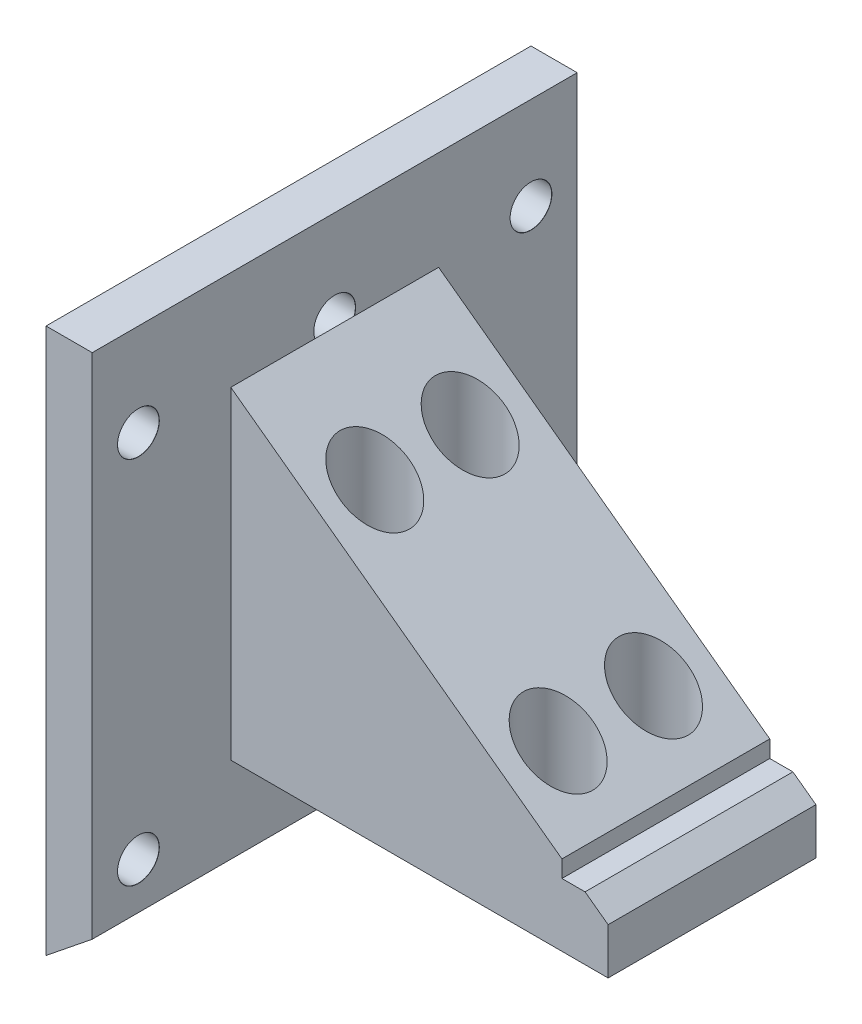
from build123d import *

# Parameters (mm, degrees)
BOSS_EXTRUDE1_DEPTH           = 22.5
BOSS_EXTRUDE1_DEPTH_BACK      = 22.5
SKETCH8_W                     = 10
SKETCH8_H                     = 120
BOSS_EXTRUDE2_DEPTH           = 30
M8_CLEARANCE_HOLE2_AT_2_COUNT = 2
M8_CLEARANCE_HOLE2_AT_2_PITCH = 90.58835466
M8_CLEARANCE_HOLE2_AT_3_COUNT = 2
M8_CLEARANCE_HOLE2_AT_3_PITCH = 42.5
BOSS_EXTRUDE3_REACH           = 134.793
SKETCH2_R                     = 2.38
CUT_EXTRUDE1_DEPTH            = 60
CHAMFER4_SIZE                 = 10
CHAMFER4_SIZE_2               = 12.433047379
SKETCH18_R                    = 7.5
CUT_EXTRUDE4_DEPTH            = 85
SKETCH19_W                    = 61.758143573
SKETCH19_H                    = 25.520807093
CUT_EXTRUDE5_DEPTH            = 10


with BuildPart() as part:
    # Sketch1 → Boss-Extrude1 (new, two sides: drawn at the far end of the back side and taken through both)
    with BuildSketch(Plane.XY.offset(-BOSS_EXTRUDE1_DEPTH_BACK)):
        Polygon((0, 60), (10, 60), (10, -21.4124), (91.7, -21.4124), (91.7, -31.4124), (10, -31.4124), (10, -60), (0, -60), align=None)
    extrude(amount=BOSS_EXTRUDE1_DEPTH + BOSS_EXTRUDE1_DEPTH_BACK)

    # Sketch8 → Boss-Extrude2 (add)
    with BuildSketch(Plane(origin=(0, 0, -22.5), x_dir=(-1, 0, 0), z_dir=(0, 0, -1))):
        with Locations((-5, 0)):
            Rectangle(SKETCH8_W, SKETCH8_H)
    boss_extrude2 = extrude(amount=BOSS_EXTRUDE2_DEPTH)

    # Sketch10 → M8 Clearance Hole2 (revolve, cut)
    with BuildSketch(Plane(origin=(10, 40, 0), x_dir=(0, 0, -1), z_dir=(0, 1, 0))):
        Polygon((0, 0), (0, 25.703872786), (4.5, 23), (4.5, 0.025), (4.525, 0), align=None)
    m8_clearance_hole2 = revolve(axis=Axis((16.35, 40, 0), (-1, 0, 0)), mode=Mode.SUBTRACT)

    # M8 Clearance Hole2 at 2: M8 Clearance Hole2 ×2
    with Locations(*[Vector(0, -0.8831157194574106, -0.4691552259617494) * (i * M8_CLEARANCE_HOLE2_AT_2_PITCH) for i in range(1, M8_CLEARANCE_HOLE2_AT_2_COUNT)]):
        add(m8_clearance_hole2, mode=Mode.SUBTRACT)

    # M8 Clearance Hole2 at 3: M8 Clearance Hole2 ×2
    with Locations(*[(0, 0, -i * M8_CLEARANCE_HOLE2_AT_3_PITCH) for i in range(1, M8_CLEARANCE_HOLE2_AT_3_COUNT)]):
        add(m8_clearance_hole2, mode=Mode.SUBTRACT)

    # Boss-Extrude3: up to this face of the body (flat: up to its plane)
    boss_extrude3_end = Plane(part.part.faces().sort_by_distance((50.85, -26.4124, -22.5))[0])
    # Sketch14 → Boss-Extrude3 (add, up to the picked face)
    with BuildSketch(Plane.XY.offset(22.5), mode=Mode.PRIVATE) as boss_extrude3_sk1:
        Polygon((91.7, -21.4124), (10, 38.5), (10, -21.4124), align=None)
    boss_extrude3_tool1 = split(extrude(boss_extrude3_sk1.sketch, amount=-BOSS_EXTRUDE3_REACH, mode=Mode.PRIVATE), bisect_by=boss_extrude3_end, keep=Keep.BOTH, mode=Mode.PRIVATE)
    add(boss_extrude3_tool1.solids().sort_by(Axis((37.233333, -1.4416, 22.5), (0, 0, -1)))[0])

    # Sketch2 → Cut-Extrude1 (cut)
    with BuildSketch(Plane(origin=(0, -31.4124, 0), x_dir=(1, 0, 0), z_dir=(0, 1, 0))):
        with Locations((68.7, 10.325)):
            Circle(SKETCH2_R)
        with Locations((68.7, -10.325)):
            Circle(SKETCH2_R)
        with Locations((29, 10.325)):
            Circle(SKETCH2_R)
        with Locations((29, -10.325)):
            Circle(SKETCH2_R)
    extrude(amount=CUT_EXTRUDE1_DEPTH, mode=Mode.SUBTRACT)

    # Mirror2: Boss-Extrude2, M8 Clearance Hole2 across plane
    add(boss_extrude2.mirror(Plane.XY))
    add(m8_clearance_hole2.mirror(Plane.XY), mode=Mode.SUBTRACT)

    # Mirror2 copy 1 sketch → Mirror2 copy 1 (revolve, cut)
    with BuildSketch(Plane(origin=(10, -40, 42.5), x_dir=(0, 0, 1), z_dir=(0, 1, 0))):
        Polygon((0, 0), (0, -25.703872786), (4.5, -23), (4.5, -0.025), (4.525, 0), align=None)
    revolve(axis=Axis((16.35, -40, 42.5), (1, 0, 0)), mode=Mode.SUBTRACT)

    # Mirror2 copy 2 sketch → Mirror2 copy 2 (revolve, cut)
    with BuildSketch(Plane(origin=(10, 40, 42.5), x_dir=(0, 0, 1), z_dir=(0, 1, 0))):
        Polygon((0, 0), (0, -25.703872786), (4.5, -23), (4.5, -0.025), (4.525, 0), align=None)
    revolve(axis=Axis((16.35, 40, 42.5), (1, 0, 0)), mode=Mode.SUBTRACT)

    # Chamfer4
    # the kernel refuses this chamfer: 12.433047379, 10 mm, written as the material it takes off along each edge
    with BuildSketch(Plane(origin=(10, -60, 84.560907877), x_dir=(0.03755485384602002, 0.9992945676589081, 0), z_dir=(0, 0, -1))) as chamfer4_piece_1:
        Polygon((CHAMFER4_SIZE * 0.999294567659, -CHAMFER4_SIZE * 0.037554853846), (-CHAMFER4_SIZE_2 * 0.037554853846, -CHAMFER4_SIZE_2 * 0.999294567658), (0, 0), align=None)
    extrude(amount=169.121815753, mode=Mode.SUBTRACT)

    # Sketch18 → Cut-Extrude4 (cut)
    with BuildSketch(Plane(origin=(0, 60, 0), x_dir=(1, 0, 0), z_dir=(0, 1, 0))):
        with Locations(Location((29, 10.325, 0), (0, 0, 270))):
            Circle(SKETCH18_R)
        with Locations(Location((29, -10.325, 0), (0, 0, 270))):
            Circle(SKETCH18_R)
        with Locations(Location((68.7, 10.325, 0), (0, 0, 270))):
            Circle(SKETCH18_R)
        with Locations(Location((68.7, -10.325, 0), (0, 0, 270))):
            Circle(SKETCH18_R)
    extrude(amount=-CUT_EXTRUDE4_DEPTH, mode=Mode.SUBTRACT)

    # Sketch19 → Cut-Extrude5 (cut)
    with BuildSketch(Plane(origin=(91.7, 0, 0), x_dir=(0, 0, -1), z_dir=(1, 0, 0))):
        with Locations((3.038191321, -4.992790305)):
            Rectangle(SKETCH19_W, SKETCH19_H)
    extrude(amount=-CUT_EXTRUDE5_DEPTH, mode=Mode.SUBTRACT)


solid = part.part
